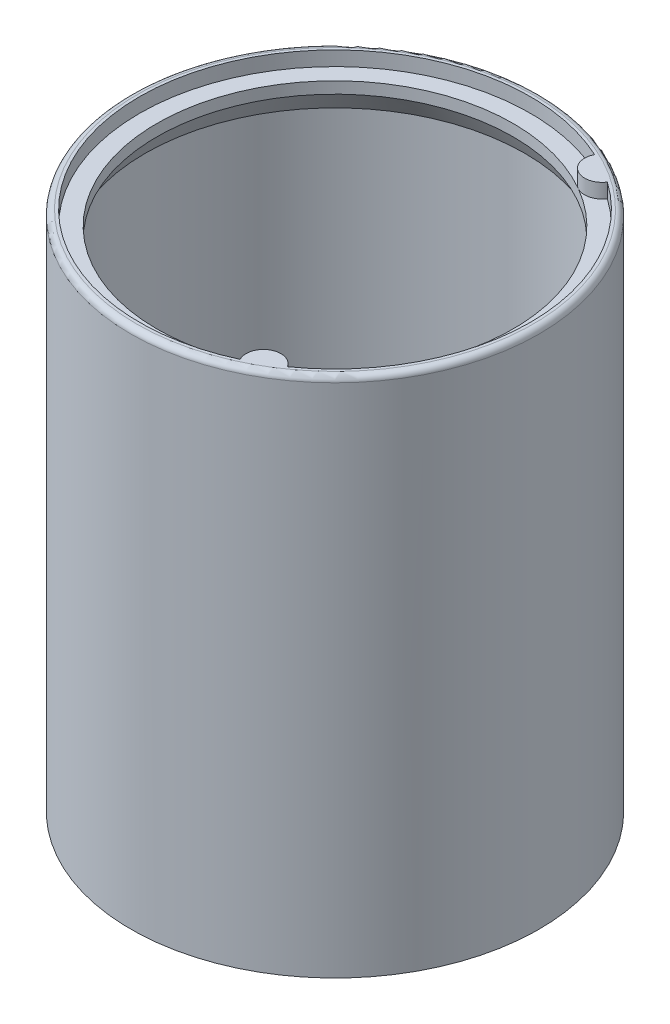
from build123d import *

# Parameters (mm, degrees)
ESQUISSE1_R             = 35.25
BOSS_EXTRU_1_DEPTH      = 90
CONG_1_R                = 1
ESQUISSE4_R             = 33.75
ENL_V_MAT_EXTRU_3_DEPTH = 2.5
ESQUISSE5_R             = 32.75
ENL_V_MAT_EXTRU_4_DEPTH = 84
ESQUISSE6_R             = 33.75
ESQUISSE6_R_2           = 30.75
BOSS_EXTRU_2_DEPTH      = 10
CHANFREIN1_SIZE         = 8
CHANFREIN1_SIZE_2       = 4.618802154
BOSS_EXTRU_3_START      = 2.5
BOSS_EXTRU_3_DEPTH      = 2.5
ESQUISSE8_R             = 6.2
BOSS_EXTRU_4_DEPTH      = 8
ESQUISSE2_R             = 3.2
ENL_V_MAT_EXTRU_1_DEPTH = 103.884036697
CONG_2_R                = 1.5


with BuildPart() as part:
    # Esquisse1 → Boss.-Extru.1 (new body)
    with BuildSketch(Plane(origin=(0, 0, 0), x_dir=(1, 0, 0), z_dir=(0, 1, 0))):
        with Locations(Location((0, 0, 0), (0, 0, 90))):
            Circle(ESQUISSE1_R)
    extrude(amount=BOSS_EXTRU_1_DEPTH)

    # Congé1
    cong_1_edges = [part.edges().sort_by_distance(p)[0] for p in [
        (0, 90, 35.25),
    ]]
    fillet(cong_1_edges, radius=CONG_1_R)

    # Esquisse4 → Enlèv. mat.-Extru.3 (cut)
    with BuildSketch(Plane(origin=(0, 90, 0), x_dir=(1, 0, 0), z_dir=(0, 1, 0))):
        with Locations(Location((0, 0, 0), (0, 0, 270))):
            Circle(ESQUISSE4_R)
    extrude(amount=-ENL_V_MAT_EXTRU_3_DEPTH, mode=Mode.SUBTRACT)

    # Esquisse5 → Enlèv. mat.-Extru.4 (cut)
    with BuildSketch(Plane(origin=(0, 87.5, 0), x_dir=(1, 0, 0), z_dir=(0, 1, 0))):
        with Locations(Location((0, 0, 0), (0, 0, 270))):
            Circle(ESQUISSE5_R)
    extrude(amount=-ENL_V_MAT_EXTRU_4_DEPTH, mode=Mode.SUBTRACT)

    # Esquisse6 → Boss.-Extru.2 (add)
    with BuildSketch(Plane(origin=(0, 87.5, 0), x_dir=(1, 0, 0), z_dir=(0, 1, 0))):
        with Locations(Location((0, 0, 0), (0, 0, 270))):
            Circle(ESQUISSE6_R)
        with Locations(Location((0, 0, 0), (0, 0, 270))):
            Circle(ESQUISSE6_R_2, mode=Mode.SUBTRACT)
    extrude(amount=-BOSS_EXTRU_2_DEPTH)

    # Chanfrein1
    # the kernel refuses this chamfer: 8, 4.618802154 mm, written as the material it takes off along each edge
    with BuildSketch(Plane(origin=(0, 77.5, 0), x_dir=(0, 0, 1), z_dir=(-1, 0, 0))) as chanfrein1_piece_1_section:
        Polygon((30.75, CHANFREIN1_SIZE), (30.75 + CHANFREIN1_SIZE_2, 0), (30.75, 0), align=None)
    chanfrein1_piece_1 = revolve(axis=Axis((0, 77.5, 0), (0, 1, 0)), mode=Mode.PRIVATE)
    chanfrein1_piece_1 = chanfrein1_piece_1 & Plane(origin=(0, 83.835682002, 0), x_dir=(0, 0, 1), z_dir=(0, 1, 0)) * Cylinder(32.75, 142, mode=Mode.PRIVATE)
    add(chanfrein1_piece_1, mode=Mode.SUBTRACT)

    # Esquisse7 → Boss.-Extru.3 (add)
    with BuildSketch(Plane(origin=(0, 87.5, 0), x_dir=(1, 0, 0), z_dir=(0, 1, 0)).offset(BOSS_EXTRU_3_START)):
        with BuildLine():
            ThreePointArc((14.212824392, 30.61140511), (15.375, 26.630281166), (19.403842275, 27.614369538))
            ThreePointArc((19.403842275, 27.614369538), (16.875, 29.228357378), (14.212824392, 30.61140511))
        make_face()
        with BuildLine():
            ThreePointArc((14.212824392, -30.61140511), (16.875, -29.228357378), (19.403842275, -27.614369538))
            ThreePointArc((19.403842275, -27.614369538), (15.375, -26.630281166), (14.212824392, -30.61140511))
        make_face()
    extrude(amount=-BOSS_EXTRU_3_DEPTH)

    # Esquisse8 → Boss.-Extru.4 (add)
    with BuildSketch(Plane(origin=(0, 3.5, 0), x_dir=(1, 0, 0), z_dir=(0, 1, 0))):
        with Locations(Location((0, 0, 0), (0, 0, 270))):
            Circle(ESQUISSE8_R)
    extrude(amount=BOSS_EXTRU_4_DEPTH)

    # Esquisse2 → Enlèv. mat.-Extru.1 (cut, through all)
    with BuildSketch(Plane.XZ):
        with Locations(Location((0, 0, 0), (0, 0, 270))):
            Circle(ESQUISSE2_R)
    extrude(amount=-ENL_V_MAT_EXTRU_1_DEPTH, mode=Mode.SUBTRACT)

    # Congé2
    cong_2_edges = [part.edges().sort_by_distance(p)[0] for p in [
        (0, 3.5, -32.75),
        (0, 3.5, -6.2),
        (0, 11.5, -6.2),
    ]]
    fillet(cong_2_edges, radius=CONG_2_R)


solid = part.part
